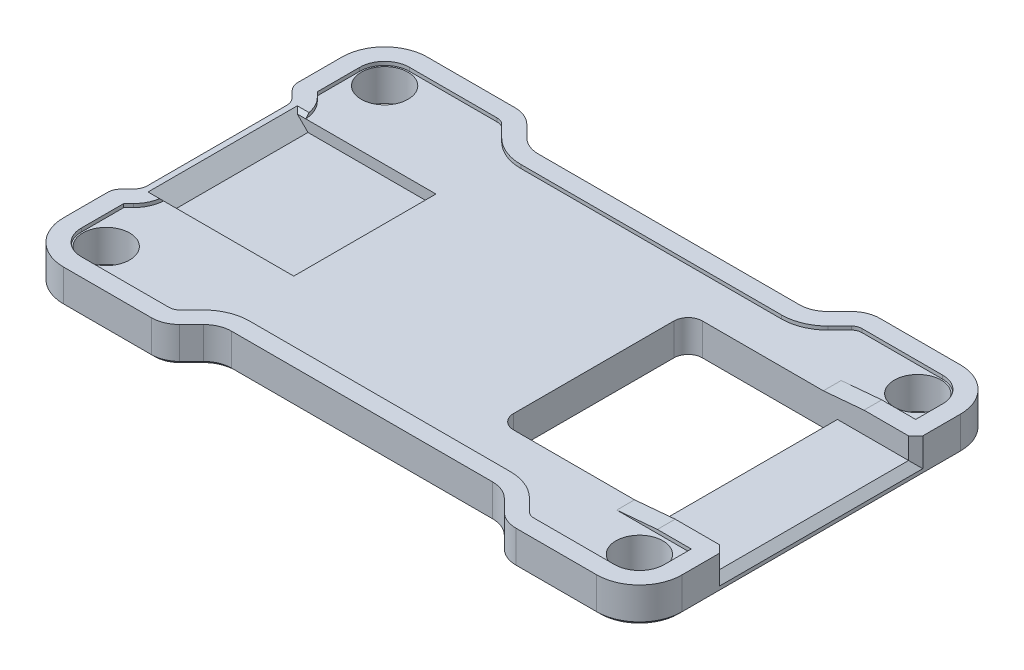
from build123d import *

# Parameters (mm, degrees)
BOSS_EXTRUDE1_DEPTH = 2.5
FILLET1_R           = 3
FILLET2_R           = 1
FILLET3_R           = 2
SKETCH3_W           = 16.773949538
SKETCH3_H           = 15.481085324
BOSS_EXTRUDE2_DEPTH = 1
CHAMFER1_SIZE       = 0.5
SKETCH5_R           = 1.65
CUT_EXTRUDE3_DEPTH  = 45.453167491
SKETCH6_W           = 10
SKETCH6_H           = 10
CUT_EXTRUDE4_DEPTH  = 1
CHAMFER2_SIZE       = 0.25
CHAMFER3_SIZE       = 0.25
SKETCH7_W           = 4
SKETCH7_H           = 13.28
CUT_EXTRUDE5_DEPTH  = 45.408153531
CHAMFER4_SIZE       = 1
CUT_EXTRUDE6_DEPTH  = 0.25
CUT_EXTRUDE8_DEPTH  = 10
SKETCH11_W          = 19.67193657
SKETCH11_H          = 16.670050146
CUT_EXTRUDE9_DEPTH  = 0.25
CHAMFER5_SIZE       = 3
CHAMFER5_SIZE_2     = 0.262465991


# Some blends are built 0.0001 mm under size
with BuildPart() as part:
    # Sketch1 → Boss-Extrude1 (new body)
    with BuildSketch(Plane(origin=(0, 0, 0), x_dir=(1, 0, 0), z_dir=(0, 1, 0))):
        Polygon((0, -5.29), (0, 5.29), (-1, 6.29), (-1, 12.79), (9, 12.79), (11, 10.79), (31, 10.79), (33, 12.79), (42.5, 12.79), (42.5, 6.64), (26.5, 6.64), (26.5, -6.64), (42.5, -6.64), (42.5, -12.79), (33, -12.79), (31, -10.79), (11, -10.79), (9, -12.79), (-1, -12.79), (-1, -6.29), align=None)
    extrude(amount=BOSS_EXTRUDE1_DEPTH)

    # Fillet1
    fillet1_edges = [part.edges().sort_by_distance(p)[0] for p in [
        (-1, 1.25, -12.79),
        (42.5, 1.25, -12.79),
        (42.5, 1.25, 12.79),
        (-1, 1.25, 12.79),
    ]]
    fillet(fillet1_edges, radius=FILLET1_R)

    # Fillet2
    fillet2_edges = [part.edges().sort_by_distance(p)[0] for p in [
        (-1, 1.25, -6.29),
        (26.5, 1.25, -6.64),
        (26.5, 1.25, 6.64),
        (-1, 1.25, 6.29),
        (0, 1.25, 5.29),
        (0, 1.25, -5.29),
    ]]
    fillet(fillet2_edges, radius=FILLET2_R)

    # Fillet3
    fillet3_edges = [part.edges().sort_by_distance(p)[0] for p in [
        (9, 1.25, -12.79),
        (11, 1.25, -10.79),
        (31, 1.25, -10.79),
        (33, 1.25, -12.79),
        (33, 1.25, 12.79),
        (31, 1.25, 10.79),
        (11, 1.25, 10.79),
        (9, 1.25, 12.79),
    ]]
    fillet(fillet3_edges, radius=FILLET3_R)

    # Sketch3 → Boss-Extrude2 (add)
    with BuildSketch(Plane.XZ):
        with Locations((34.113025231, 0.175921424)):
            Rectangle(SKETCH3_W, SKETCH3_H)
    extrude(amount=-BOSS_EXTRUDE2_DEPTH)

    # Chamfer1
    chamfer1_edges = [part.edges().sort_by_distance(p)[0] for p in [
        (42.5, 1, 0),
        (42.5, 1.75, -6.64),
        (42.5, 1.75, 6.64),
    ]]
    chamfer(chamfer1_edges, length=CHAMFER1_SIZE)

    # Sketch5 → Cut-Extrude3 (cut, through all)
    with BuildSketch(Plane(origin=(0, 2.5, 0), x_dir=(1, 0, 0), z_dir=(0, 1, 0))):
        with Locations(Location((2, 9.79, 0), (0, 0, 270))):
            Circle(SKETCH5_R)
        with Locations(Location((2, -9.79, 0), (0, 0, 270))):
            Circle(SKETCH5_R)
        with Locations(Location((39.5, 9.79, 0), (0, 0, 270))):
            Circle(SKETCH5_R)
        with Locations(Location((39.5, -9.79, 0), (0, 0, 270))):
            Circle(SKETCH5_R)
    extrude(amount=-CUT_EXTRUDE3_DEPTH, mode=Mode.SUBTRACT)

    # Sketch6 → Cut-Extrude4 (cut)
    with BuildSketch(Plane(origin=(0, 2.5, 0), x_dir=(1, 0, 0), z_dir=(0, 1, 0))):
        with Locations((5.4, 0)):
            Rectangle(SKETCH6_W, SKETCH6_H)
    extrude(amount=-CUT_EXTRUDE4_DEPTH, mode=Mode.SUBTRACT)

    # Chamfer2
    chamfer2_edges = [part.edges().sort_by_distance(p)[0] for p in [
        (10.4, 2.5, 0),
        (5.4, 2.5, -5),
        (5.4, 2.5, 5),
    ]]
    chamfer(chamfer2_edges, length=CHAMFER2_SIZE)

    # Chamfer3
    chamfer3_edges = [part.edges().sort_by_distance(p)[0] for p in [
        (36.664213562, 0, 12.79),
        (5.085786438, 0, -12.79),
        (10, 0, -11.79),
        (21, 0, -10.79),
        (32, 0, -11.79),
        (32, 0, 11.79),
        (21, 0, 10.79),
        (10, 0, 11.79),
        (8.93693974, 0, -12.637759065),
        (33.06306026, 0, -12.637759065),
        (8.93693974, 0, 12.637759065),
        (33.06306026, 0, 12.637759065),
        (30.93693974, 0, 10.942240935),
        (11.06306026, 0, 10.942240935),
        (30.93693974, 0, -10.942240935),
        (11.06306026, 0, -10.942240935),
        (42.5, 0, 0),
        (-1, 0, -8.247106781),
        (36.664213562, 0, -12.79),
        (5.085786438, 0, 12.79),
        (-0.121320344, 0, 11.911320344),
        (41.621320344, 0, 11.911320344),
        (41.621320344, 0, -11.911320344),
        (-0.121320344, 0, -11.911320344),
        (-1, 0, 8.247106781),
        (-0.5, 0, 5.79),
        (0, 0, 0),
        (-0.5, 0, -5.79),
        (-0.923879533, 0, -6.32153013),
        (-0.923879533, 0, 6.32153013),
        (-0.076120467, 0, 5.25846987),
        (-0.076120467, 0, -5.25846987),
    ]]
    chamfer(chamfer3_edges, length=CHAMFER3_SIZE)

    # Sketch7 → Cut-Extrude5 (cut, through all)
    with BuildSketch(Plane(origin=(0, 1, 0), x_dir=(1, 0, 0), z_dir=(0, 1, 0))):
        with Locations((35, 0)):
            Rectangle(SKETCH7_W, SKETCH7_H)
    extrude(amount=-CUT_EXTRUDE5_DEPTH, mode=Mode.SUBTRACT)

    # Chamfer4
    chamfer4_edges = [part.edges().sort_by_distance(p)[0] for p in [
        (0.4, 1.5, 0),
    ]]
    chamfer(chamfer4_edges, length=CHAMFER4_SIZE - 0.0001)  # a hair under: the kernel refuses the full size

    # Sketch8 → Cut-Extrude6 (cut)
    with BuildSketch(Plane(origin=(0, 2.5, 0), x_dir=(1, 0, 0), z_dir=(0, 1, 0))):
        with BuildLine():
            Line((41.25, -9.79), (41.25, -7.89))
            Line((41.25, -7.89), (27.5, -7.89))
            ThreePointArc((27.5, -7.89), (25.909009742, -7.230990258), (25.25, -5.64))
            Line((25.25, -5.64), (25.25, 5.64))
            ThreePointArc((25.25, 5.64), (25.909009742, 7.230990258), (27.5, 7.89))
            Line((27.5, 7.89), (41.25, 7.89))
            Line((41.25, 7.89), (41.25, 9.79))
            ThreePointArc((41.25, 9.79), (40.737436867, 11.027436867), (39.5, 11.54))
            Line((39.5, 11.54), (33.828427125, 11.54))
            ThreePointArc((33.828427125, 11.54), (33.54141455, 11.482909649), (33.298097039, 11.320330086))
            Line((33.298097039, 11.320330086), (32.469669914, 10.491902961))
            ThreePointArc((32.469669914, 10.491902961), (31.41529403, 9.787391519), (30.171572875, 9.54))
            Line((30.171572875, 9.54), (11.828427125, 9.54))
            ThreePointArc((11.828427125, 9.54), (10.58470597, 9.787391519), (9.530330086, 10.491902961))
            Line((9.530330086, 10.491902961), (8.701902961, 11.320330086))
            ThreePointArc((8.701902961, 11.320330086), (8.45858545, 11.482909649), (8.171572875, 11.54))
            Line((8.171572875, 11.54), (2, 11.54))
            ThreePointArc((2, 11.54), (0.762563133, 11.027436867), (0.25, 9.79))
            Line((0.25, 9.79), (0.25, 6.807766953))
            Line((0.25, 6.807766953), (0.590990258, 6.466776695))
            ThreePointArc((0.590990258, 6.466776695), (1.078728948, 5.73682416), (1.25, 4.875786438))
            Line((1.25, 4.875786438), (1.25, -4.875786438))
            ThreePointArc((1.25, -4.875786438), (1.078728948, -5.73682416), (0.590990258, -6.466776695))
            Line((0.590990258, -6.466776695), (0.25, -6.807766953))
            Line((0.25, -6.807766953), (0.25, -9.79))
            ThreePointArc((0.25, -9.79), (0.762563133, -11.027436867), (2, -11.54))
            Line((2, -11.54), (8.171572875, -11.54))
            ThreePointArc((8.171572875, -11.54), (8.45858545, -11.482909649), (8.701902961, -11.320330086))
            Line((8.701902961, -11.320330086), (9.530330086, -10.491902961))
            ThreePointArc((9.530330086, -10.491902961), (10.58470597, -9.787391519), (11.828427125, -9.54))
            Line((11.828427125, -9.54), (30.171572875, -9.54))
            ThreePointArc((30.171572875, -9.54), (31.41529403, -9.787391519), (32.469669914, -10.491902961))
            Line((32.469669914, -10.491902961), (33.298097039, -11.320330086))
            ThreePointArc((33.298097039, -11.320330086), (33.54141455, -11.482909649), (33.828427125, -11.54))
            Line((33.828427125, -11.54), (39.5, -11.54))
            ThreePointArc((39.5, -11.54), (40.737436867, -11.027436867), (41.25, -9.79))
        make_face()
    extrude(amount=-CUT_EXTRUDE6_DEPTH, mode=Mode.SUBTRACT)

    # Sketch10 → Cut-Extrude8 (cut)
    with BuildSketch(Plane(origin=(0, 1, 0), x_dir=(1, 0, 0), z_dir=(0, 1, 0))):
        with BuildLine():
            Line((27.5, -6.64), (33, -6.64))
            Line((33, -6.64), (33, 6.64))
            Line((33, 6.64), (27.5, 6.64))
            ThreePointArc((27.5, 6.64), (26.792893219, 6.347106781), (26.5, 5.64))
            Line((26.5, 5.64), (26.5, -5.64))
            ThreePointArc((26.5, -5.64), (26.792893219, -6.347106781), (27.5, -6.64))
        make_face()
    extrude(amount=-CUT_EXTRUDE8_DEPTH, mode=Mode.SUBTRACT)

    # Sketch11 → Cut-Extrude9 (cut)
    with BuildSketch(Plane(origin=(0, 2.5, 0), x_dir=(1, 0, 0), z_dir=(0, 1, 0))):
        with Locations((26.029913711, 0)):
            Rectangle(SKETCH11_W, SKETCH11_H)
    extrude(amount=-CUT_EXTRUDE9_DEPTH, mode=Mode.SUBTRACT)

    # Chamfer5
    # the kernel refuses this chamfer: 3, 0.262465991 mm, written as the material it takes off along each edge
    with BuildSketch(Plane(origin=(35.865881996, 2.5, 15.68890224), x_dir=(0.9999943799678764, 0.0033526157940331697, 0), z_dir=(0, 0, -1))) as chamfer5_piece_1_section:
        Polygon((CHAMFER5_SIZE * 0.999994379968, CHAMFER5_SIZE * 0.00335261579403), (-CHAMFER5_SIZE_2 * 0.00335261578864, CHAMFER5_SIZE_2 * 0.999994378359), (0, 0), align=None)
    chamfer5_piece_1 = extrude(amount=16.847804479, mode=Mode.PRIVATE)
    chamfer5_piece_1 = split(chamfer5_piece_1, bisect_by=Plane(origin=(36.868035548, 2.25, 7.265), z_dir=(0, 1, 0)), keep=Keep.TOP, mode=Mode.PRIVATE)
    chamfer5_piece_1 = split(chamfer5_piece_1, bisect_by=Plane(origin=(36.868035548, 2.412888159, 11.54), z_dir=(0, 0, -1)), keep=Keep.TOP, mode=Mode.PRIVATE)
    add(chamfer5_piece_1, mode=Mode.SUBTRACT)
    with BuildSketch(Plane(origin=(35.865881996, 2.5, 1.15890224), x_dir=(0.9999943799678764, 0.0033526157940331697, 0), z_dir=(0, 0, -1))) as chamfer5_piece_2_section:
        Polygon((CHAMFER5_SIZE * 0.999994379968, CHAMFER5_SIZE * 0.00335261579403), (-CHAMFER5_SIZE_2 * 0.00335261578864, CHAMFER5_SIZE_2 * 0.999994378359), (0, 0), align=None)
    chamfer5_piece_2 = extrude(amount=9.04890224, mode=Mode.PRIVATE)
    chamfer5_piece_2 = split(chamfer5_piece_2, bisect_by=Plane(origin=(36.868035548, 2.25, -7.265), z_dir=(0, 1, 0)), keep=Keep.TOP, mode=Mode.PRIVATE)
    add(chamfer5_piece_2, mode=Mode.SUBTRACT)


solid = part.part
